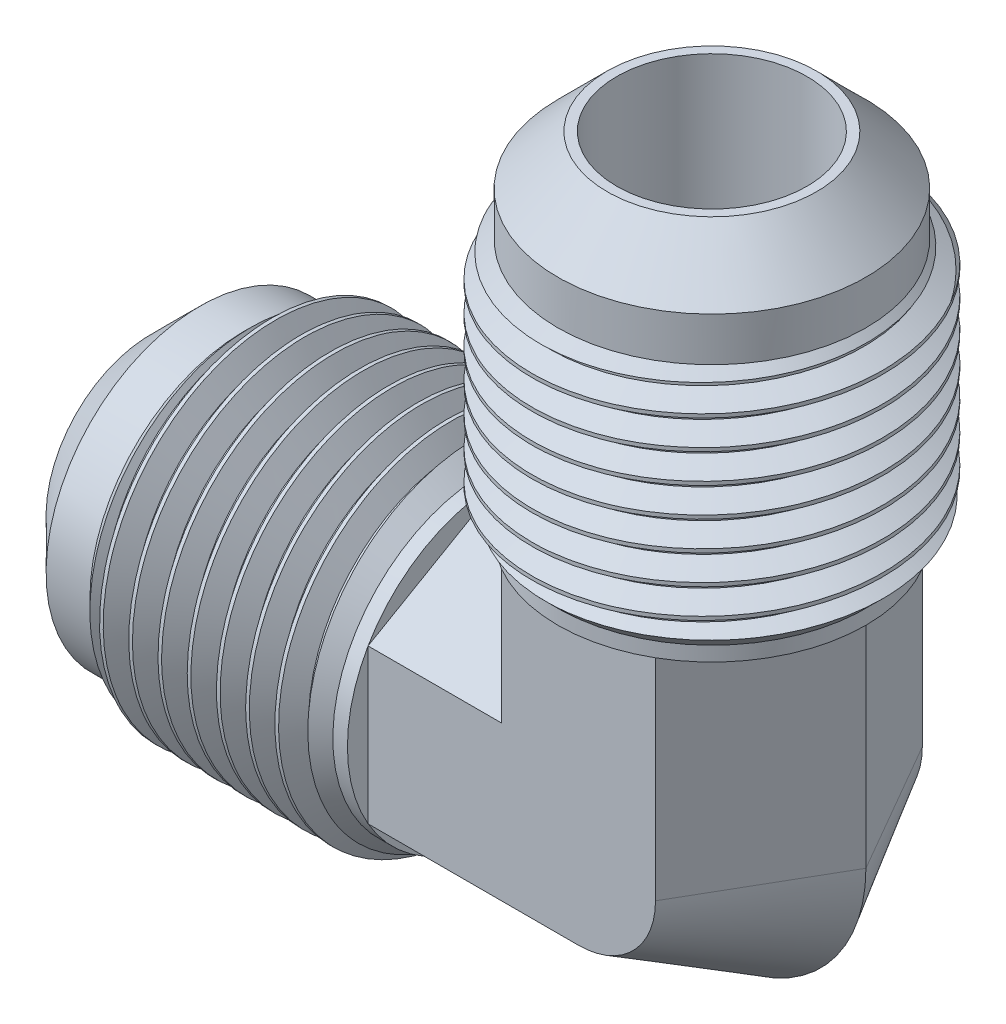
from build123d import *

# Parameters (mm, degrees)
SKETCH1_W           = 19.05
SKETCH1_H           = 9.525
CUT_SWEEP2_PITCH    = 1.5875
SKETCH11_R          = 5.1689
CUT_EXTRUDE1_DEPTH  = 24.331389882
CIRPATTERN1_COUNT   = 2
CIRPATTERN1_ANGLE   = 90
SKETCH7_R           = 5.1689
BOSS_EXTRUDE1_DEPTH = 11.43
SKETCH14_R          = 5.1689
BOSS_EXTRUDE2_DEPTH = 11.43
REVOLVE2_ANGLE      = 90
SKETCH16_R          = 5.1689
CUT_EXTRUDE2_DEPTH  = 30.48
SKETCH17_R          = 5.1689
CUT_EXTRUDE3_DEPTH  = 30.48


with BuildPart() as part:
    # Sketch1 → Revolve1 (revolve)
    with BuildSketch(Plane.XY, mode=Mode.PRIVATE) as revolve1_sk:
        with Locations((9.525, 4.7625)):
            Rectangle(SKETCH1_W, SKETCH1_H)
    revolve(revolve1_sk.sketch.rotate(Axis((0, 0, 0), (1, 0, 0)), 90), axis=Axis((0, 0, 0), (1, 0, 0)))

    # Cut-Sweep2: the profile of Sketch13 profile screwed along a right-hand helix of 13 turns, 8 arcs to a turn; built about Z, then put on its axis
    cut_sweep2_z = Axis((0, 0, 0), (0, 0, 1))
    cut_sweep2_corners = [(9.5253, 0, -1.389235705), (9.5253, 0, 0.000173205), (8.493888504, 0, -0.5953125), (8.493888504, 0, -0.79375)]
    with BuildLine(mode=Mode.PRIVATE) as cut_sweep2_profile:
        Line(cut_sweep2_corners[0], cut_sweep2_corners[1])
        Line(cut_sweep2_corners[1], cut_sweep2_corners[2])
        Line(cut_sweep2_corners[2], cut_sweep2_corners[3])
        Line(cut_sweep2_corners[3], cut_sweep2_corners[0])
    cut_sweep2_cap = Face(cut_sweep2_profile.wire())
    cut_sweep2_turn_angles = [0, 22.5, 45, 67.5, 90, 112.5, 135, 157.5, 180, 202.5, 225, 247.5, 270, 292.5, 315, 337.5, 360]
    cut_sweep2_turn_weights = [1, 0.9238795325112867, 1, 0.9238795325112867, 1, 0.9238795325112867, 1, 0.9238795325112867, 1, 0.9238795325112867, 1, 0.9238795325112867, 1, 0.9238795325112867, 1, 0.9238795325112867, 1]
    cut_sweep2_turn_rails = [Edge.make_bspline([Vector(p[0], p[1], 0).rotate(cut_sweep2_z, cut_sweep2_turn_angles[k]) / cut_sweep2_turn_weights[k] + Vector(0, 0, p[2] + CUT_SWEEP2_PITCH * cut_sweep2_turn_angles[k] / 360) for k in range(17)], [0, 0, 0, 1, 1, 2, 2, 3, 3, 4, 4, 5, 5, 6, 6, 7, 7, 8, 8, 8], 2, cut_sweep2_turn_weights) for p in cut_sweep2_corners]
    cut_sweep2_turn_sides = [Face.make_surface_from_curves(cut_sweep2_turn_rails[p[0]], cut_sweep2_turn_rails[p[1]]) for p in [(0, 1), (1, 2), (2, 3), (3, 0)]]
    cut_sweep2 = Plane(origin=(0, 0, 0), x_dir=(0, 1, 0), z_dir=(1, 0, 0)) * Solid(Shell([*[p.moved(Location((0, 0, CUT_SWEEP2_PITCH * i))) for i in range(13) for p in cut_sweep2_turn_sides], cut_sweep2_cap, cut_sweep2_cap.rotate(cut_sweep2_z, 4680).moved(Location((0, 0, CUT_SWEEP2_PITCH * 4680 / 360)))]))
    add(cut_sweep2, mode=Mode.SUBTRACT)

    # Sketch3 → Cut-Revolve2 (revolve, cut)
    with BuildSketch(Plane.XY, mode=Mode.PRIVATE) as cut_revolve2_sk:
        Polygon((2.681098504, 8.366888504), (0, 5.68579), (0, 9.525), (6.22046, 9.525), (5.062348504, 8.366888504), align=None)
        Polygon((19.05, 9.525), (19.05, 8.366888504), (18.25625, 8.366888504), (17.098138504, 9.525), align=None)
    revolve(cut_revolve2_sk.sketch.rotate(Axis((0, 0, 0), (1, 0, 0)), 180), axis=Axis((0, 0, 0), (1, 0, 0)), mode=Mode.SUBTRACT)

    # Sketch11 → Cut-Extrude1 (cut, through all)
    with BuildSketch(Plane.ZY):
        Circle(SKETCH11_R)
    extrude(amount=-CUT_EXTRUDE1_DEPTH, mode=Mode.SUBTRACT)


with BuildPart() as cirpattern1_1:
    # CirPattern1: pattern copy
    add(part.part.rotate(Axis((30.48, 0, 0), (0, 0, -1)), 1 * CIRPATTERN1_ANGLE / (CIRPATTERN1_COUNT - 1)))


with BuildPart() as part_1:
    add(part.part)

    # Sketch7 → Boss-Extrude1 (add)
    with BuildSketch(Plane(origin=(19.05, 0, 0), x_dir=(0, 0, -1), z_dir=(1, 0, 0))):
        Polygon((7.245937995, -4.183444252), (7.245937995, 4.183444252), (0, 8.366888504), (-7.245937995, 4.183444252), (-7.245937995, -4.183444252), (0, -8.366888504), align=None)
        with Locations(Location((0, 0, 0), (0, 0, 180))):
            Circle(SKETCH7_R, mode=Mode.SUBTRACT)
    extrude(amount=BOSS_EXTRUDE1_DEPTH)

    add(cirpattern1_1.part)  # Boss-Extrude2 merges CirPattern1_1
    # Sketch14 → Boss-Extrude2 (add)
    with BuildSketch(Plane.XZ.offset(-11.43)):
        Polygon((26.296555748, 7.245937995), (22.113111496, 0), (26.296555748, -7.245937995), (34.663444252, -7.245937995), (38.846888504, 0), (34.663444252, 7.245937995), align=None)
        with Locations(Location((30.48, 0, 0), (0, 0, 90))):
            Circle(SKETCH14_R, mode=Mode.SUBTRACT)
    extrude(amount=BOSS_EXTRUDE2_DEPTH)

    # Sketch15 → Revolve2 (revolve)
    with BuildSketch(Plane.XZ):
        with BuildLine():
            Line((30.48, -5.1689), (30.48, -7.245937995))
            Line((30.48, -7.245937995), (34.663444252, -7.245937995))
            Line((34.663444252, -7.245937995), (38.846888504, 0))
            Line((38.846888504, 0), (34.663444252, 7.245937995))
            Line((34.663444252, 7.245937995), (30.48, 7.245937995))
            Line((30.48, 7.245937995), (30.48, 5.1689))
            ThreePointArc((30.48, 5.1689), (35.6489, 0), (30.48, -5.1689))
        make_face()
    revolve(axis=Axis((30.48, 0, 7.245937995), (0, 0, -1)), revolution_arc=REVOLVE2_ANGLE)

    # Sketch16 → Cut-Extrude2 (cut)
    with BuildSketch(Plane(origin=(0, 30.48, 0), x_dir=(1, 0, 0), z_dir=(0, 1, 0))):
        with Locations(Location((30.48, 0, 0), (0, 0, 270))):
            Circle(SKETCH16_R)
    extrude(amount=-CUT_EXTRUDE2_DEPTH, mode=Mode.SUBTRACT)

    # Sketch17 → Cut-Extrude3 (cut)
    with BuildSketch(Plane.ZY):
        Circle(SKETCH17_R)
    extrude(amount=-CUT_EXTRUDE3_DEPTH, mode=Mode.SUBTRACT)


solid = part_1.part
